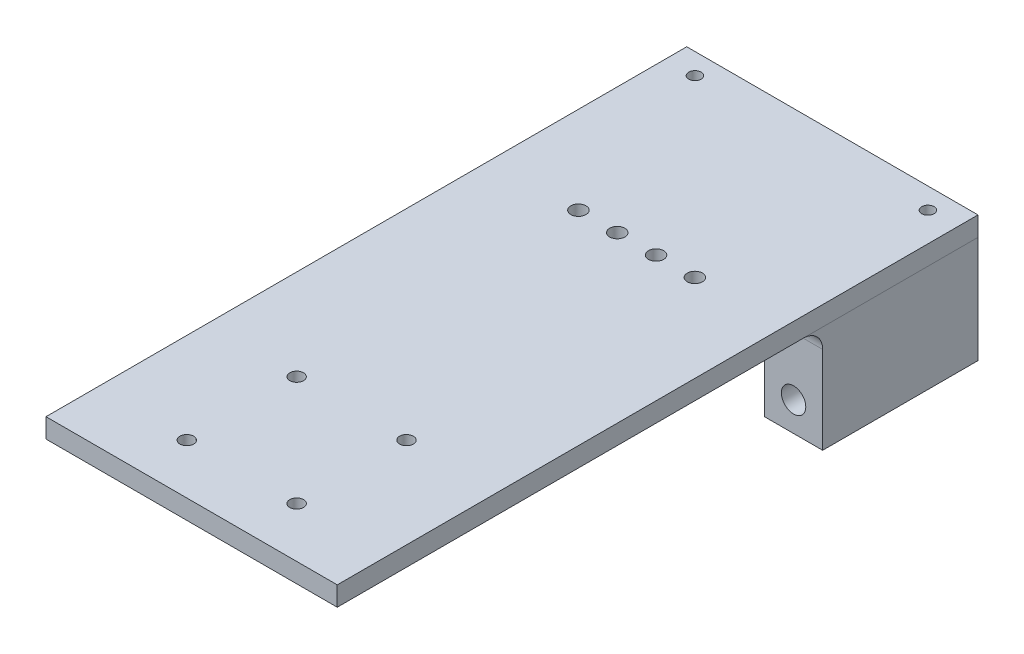
from build123d import *

# Parameters (mm, degrees)
BOSS_EXTRUDE1_DEPTH = 25.4
FILLET1_R           = 6.35
SKETCH2_R           = 4.0005
SKETCH2_R_2         = 4
CUT_EXTRUDE1_DEPTH  = 50.8
SKETCH4_W           = 95.25
SKETCH4_H           = 6.35
BOSS_EXTRUDE3_DEPTH = 158.75
SKETCH5_R           = 2.0193
CUT_EXTRUDE2_DEPTH  = 12.7
FILLET2_R           = 6.35
SKETCH6_R           = 2.2479
CUT_EXTRUDE3_DEPTH  = 6.35
SKETCH10_R          = 2.4892
CUT_EXTRUDE4_DEPTH  = 195.635527975


# Read off the part's stored shape, not the designer's step: Split1
with BuildPart() as part:
    # Sketch1 → Boss-Extrude1 (new, symmetric)
    with BuildSketch(Plane.XY):
        Polygon((-47.625, 0), (47.625, 0), (47.625, -41.275), (28.575, -41.275), (28.575, -12.7), (-28.575, -12.7), (-28.575, -41.275), (-47.625, -41.275), align=None)
    extrude(amount=BOSS_EXTRUDE1_DEPTH, both=True)

    # Fillet1
    fillet1_edges = [part.edges().sort_by_distance(p)[0] for p in [
        (28.575, -12.7, 0),
        (-28.575, -12.7, 0),
    ]]
    fillet(fillet1_edges, radius=FILLET1_R)

    # Sketch2 → Cut-Extrude1 (cut)
    with BuildSketch(Plane.XY.offset(25.4)):
        with Locations((-38.1, -31.75)):
            Circle(SKETCH2_R)
        with Locations((38.1, -31.75)):
            Circle(SKETCH2_R_2)
    extrude(amount=-CUT_EXTRUDE1_DEPTH, mode=Mode.SUBTRACT)

    # Sketch4 → Boss-Extrude3 (add)
    with BuildSketch(Plane.XY.offset(25.4)):
        with Locations((0, -3.175)):
            Rectangle(SKETCH4_W, SKETCH4_H)
    extrude(amount=BOSS_EXTRUDE3_DEPTH)

    # Sketch5 → Cut-Extrude2 (cut)
    with BuildSketch(Plane(origin=(0, 0, 0), x_dir=(1, 0, 0), z_dir=(0, 1, 0))):
        with Locations(Location((-38.1, 18.542, 0), (0, 0, 180))):
            Circle(SKETCH5_R)
    cut_extrude2 = extrude(amount=-CUT_EXTRUDE2_DEPTH, mode=Mode.SUBTRACT)

    # Mirror1: Cut-Extrude2 across plane
    add(cut_extrude2.mirror(Plane(origin=(0, 0, 0), x_dir=(0, 0, 1), z_dir=(1, 0, 0))), mode=Mode.SUBTRACT)

    # Fillet2
    fillet2_edges = [part.edges().sort_by_distance(p)[0] for p in [
        (0, -6.35, 25.4),
    ]]
    fillet(fillet2_edges, radius=FILLET2_R - 0.0001)  # a hair under: the kernel refuses the full size

    # Sketch6 → Cut-Extrude3 (cut)
    with BuildSketch(Plane(origin=(0, 0, 0), x_dir=(1, 0, 0), z_dir=(0, 1, 0))):
        with Locations(Location((-17.960512242, -167.767, 0), (0, 0, 180))):
            Circle(SKETCH6_R)
        with Locations(Location((-17.960512242, -131.845975516, 0), (0, 0, 180))):
            Circle(SKETCH6_R)
        with Locations(Location((17.960512242, -167.767, 0), (0, 0, 180))):
            Circle(SKETCH6_R)
        with Locations(Location((17.960512242, -131.845975516, 0), (0, 0, 180))):
            Circle(SKETCH6_R)
    extrude(amount=-CUT_EXTRUDE3_DEPTH, mode=Mode.SUBTRACT)

    # Sketch10 → Cut-Extrude4 (cut, through all)
    with BuildSketch(Plane(origin=(0, 0, 0), x_dir=(1, 0, 0), z_dir=(0, 1, 0))):
        with Locations(Location((-6.35, -38.608, 0), (0, 0, 180))):
            Circle(SKETCH10_R)
        with Locations(Location((-19.05, -38.608, 0), (0, 0, 180))):
            Circle(SKETCH10_R)
    cut_extrude4 = extrude(amount=-CUT_EXTRUDE4_DEPTH, mode=Mode.SUBTRACT)

    # Mirror2: Cut-Extrude4 across plane
    add(cut_extrude4.mirror(Plane(origin=(0, 0, 0), x_dir=(0, 0, 1), z_dir=(1, 0, 0))), mode=Mode.SUBTRACT)


with BuildPart() as body_2:
    # Split1: the piece on the far side of the plane
    add(part.part)
    split(bisect_by=Plane(origin=(0, -6.35, 0), x_dir=(1, 0, 0), z_dir=(0, 1, 0)), keep=Keep.BOTTOM)


with BuildPart() as part_1:
    add(part.part)

    # Split1
    split(bisect_by=Plane(origin=(0, -6.35, 0), x_dir=(1, 0, 0), z_dir=(0, 1, 0)), keep=Keep.TOP)


solid = Compound([body_2.part, part_1.part])
